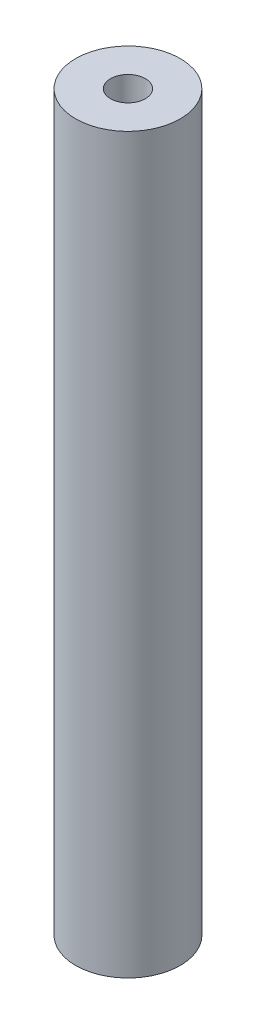
from build123d import *

# Parameters (mm, degrees)
SKETCH1_R           = 47.625
SKETCH1_R_2         = 15.875
BOSS_EXTRUDE1_DEPTH = 334.01


with BuildPart() as part:
    # Sketch1 → Boss-Extrude1 (new, symmetric)
    with BuildSketch(Plane(origin=(0, 0, 0), x_dir=(1, 0, 0), z_dir=(0, 1, 0))):
        Circle(SKETCH1_R)
        Circle(SKETCH1_R_2, mode=Mode.SUBTRACT)
    extrude(amount=BOSS_EXTRUDE1_DEPTH, both=True)


solid = part.part
